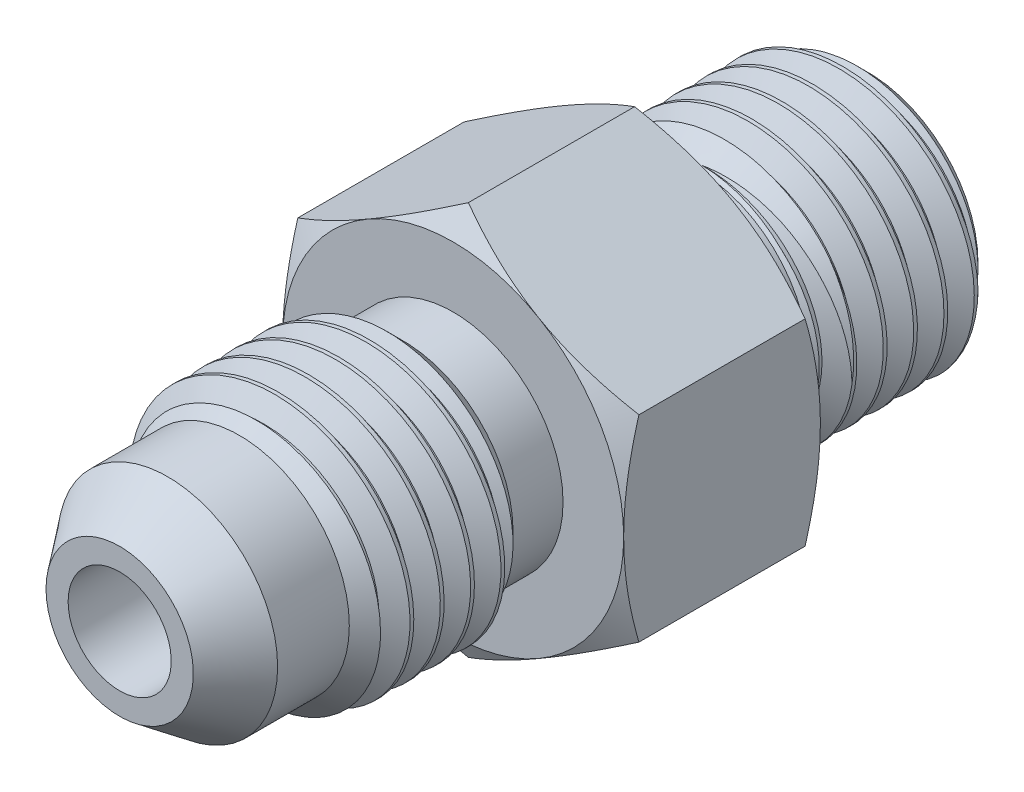
from build123d import *

# Parameters (mm, degrees)
BOSS_EXTRUDE1_DEPTH    = 8.239125
SKETCH6_OUTSIDE_W      = 98.49
SKETCH6_OUTSIDE_H      = 100.7
SKETCH6_OUTSIDE_R      = 7.14375
CUT_EXTRUDE1_DEPTH     = 21.524385925
CUT_EXTRUDE1_DRAFT     = -60
SKETCH7_OUTSIDE_W      = 113.112
SKETCH7_OUTSIDE_H      = 115.322
SKETCH7_OUTSIDE_R      = 7.14375
CUT_EXTRUDE2_DEPTH     = 25.745153386
CUT_EXTRUDE2_DRAFT     = -60
SKETCH8_R              = 0.47625
CUT_SWEEP1_PITCH       = 1.27
CUT_SWEEP1_HEIGHT      = 8.128
CUT_SWEEP1_RADIUS      = 5.55625
CUT_SWEEP1_START_ANGLE = 90
CUT_SWEEP2_PITCH       = 1.27
BOSS_EXTRUDE2_START    = -8.239125
SKETCH13_R             = 7.14375
SKETCH13_R_2           = 2.159
BOSS_EXTRUDE2_DEPTH    = 8.239125


with BuildPart() as part:
    # Sketch3 → Revolve1 (revolve)
    with BuildSketch(Plane(origin=(0, 0, 0), x_dir=(0, 0, -1), z_dir=(1, 0, 0)), mode=Mode.PRIVATE) as revolve1_sk:
        Polygon((-3.8020625, 4.60375), (-1.7065625, 4.60375), (6.5325625, 4.60375), (8.5645625, 4.60375), (9.5170625, 5.55625), (14.7240625, 5.55625), (15.6765625, 4.60375), (15.6765625, 2.159), (6.5325625, 2.159), (-1.7065625, 2.159), (-15.6765625, 2.159), (-15.6765625, 3.0861), (-13.662572926, 4.60375), (-10.6600625, 4.60375), (-9.7075625, 5.55625), (-4.7545625, 5.55625), align=None)
    revolve(revolve1_sk.sketch.rotate(Axis((0, 0, -15.6765625), (0, 0, 1)), 90), axis=Axis((0, 0, -15.6765625), (0, 0, 1)))

    # Sketch4 → Boss-Extrude1 (add)
    with BuildSketch(Plane.XY.offset(1.7065625)):
        Polygon((-7.14375, 4.124445986), (-7.14375, -4.124445986), (0, -8.248891971), (7.14375, -4.124445986), (7.14375, 4.124445986), (0, 8.248891971), align=None)
    extrude(amount=-BOSS_EXTRUDE1_DEPTH)

    # Sketch5 → Cut-Revolve1 (revolve, cut)
    with BuildSketch(Plane(origin=(0, 0, 0), x_dir=(0, 0, -1), z_dir=(1, 0, 0)), mode=Mode.PRIVATE) as cut_revolve1_sk:
        Polygon((15.6765625, 0), (-15.6765625, 0), (-15.6765625, 2.159), (-1.7065625, 2.159), (6.5325625, 2.159), (15.6765625, 2.159), align=None)
    revolve(cut_revolve1_sk.sketch.rotate(Axis((0, 0, -15.6765625), (0, 0, 1)), 90), axis=Axis((0, 0, -15.6765625), (0, 0, 1)), mode=Mode.SUBTRACT)


with BuildPart() as cut_extrude1_tool:
    # Sketch6 outside → Cut-Extrude1 (with draft: the straight prism first)
    with BuildSketch(Plane.XY.offset(1.7065625)):
        Rectangle(SKETCH6_OUTSIDE_W, SKETCH6_OUTSIDE_H)
        Circle(SKETCH6_OUTSIDE_R, mode=Mode.SUBTRACT)
    extrude(amount=-CUT_EXTRUDE1_DEPTH)
    # Cut-Extrude1: the draft: its side faces are tilted about the plane it starts from
    cut_extrude1_sides = [cut_extrude1_tool.faces().sort_by_distance(p)[0] for p in [
        (0, -50.35, -9.055630462),
        (49.245, 0, -9.055630462),
        (0, 50.35, -9.055630462),
        (-49.245, 0, -9.055630462),
        (-7.14375, 0, -9.055630462),
    ]]
    draft(cut_extrude1_sides, Plane.XY.offset(1.7065625), CUT_EXTRUDE1_DRAFT)


with BuildPart() as part_1:
    add(part.part)

    # Cut-Extrude1: cut by cut_extrude1_tool
    add(cut_extrude1_tool.part, mode=Mode.SUBTRACT)


with BuildPart() as cut_extrude2_tool:
    # Sketch7 outside → Cut-Extrude2 (with draft: the straight prism first)
    with BuildSketch(Plane(origin=(0, 0, -6.5325625), x_dir=(-1, 0, 0), z_dir=(0, 0, -1))):
        Rectangle(SKETCH7_OUTSIDE_W, SKETCH7_OUTSIDE_H)
        Circle(SKETCH7_OUTSIDE_R, mode=Mode.SUBTRACT)
    extrude(amount=-CUT_EXTRUDE2_DEPTH)
    # Cut-Extrude2: the draft: its side faces are tilted about the plane it starts from
    cut_extrude2_sides = [cut_extrude2_tool.faces().sort_by_distance(p)[0] for p in [
        (0, -57.661, 6.340014193),
        (-56.556, 0, 6.340014193),
        (0, 57.661, 6.340014193),
        (56.556, 0, 6.340014193),
        (7.14375, 0, 6.340014193),
    ]]
    draft(cut_extrude2_sides, Plane(origin=(0, 0, -6.5325625), x_dir=(-1, 0, 0), z_dir=(0, 0, -1)), CUT_EXTRUDE2_DRAFT)


with BuildPart() as part_2:
    add(part_1.part)

    # Cut-Extrude2: cut by cut_extrude2_tool
    add(cut_extrude2_tool.part, mode=Mode.SUBTRACT)

    # Cut-Sweep1: sweep along a helix
    with BuildLine() as cut_sweep1_path:
        add(Helix(CUT_SWEEP1_PITCH, CUT_SWEEP1_HEIGHT, CUT_SWEEP1_RADIUS, center=(0, 0, 10.6600625), direction=(0, 0, -1), mode=Mode.PRIVATE).rotate(Axis((0, 0, 10.6600625), (0, 0, -1)), CUT_SWEEP1_START_ANGLE))
    # Sketch10 → Cut-Sweep1 (sweep, cut)
    with BuildSketch(Plane(origin=(0, 0, 0), x_dir=(0, 0, -1), z_dir=(1, 0, 0))):
        Polygon((-11.2950625, 4.731360803), (-11.1363125, 4.731360803), (-10.620375, 5.624990766), (-11.811, 5.624990766), align=None)
    sweep(path=cut_sweep1_path.line, is_frenet=True, mode=Mode.SUBTRACT)

    # Cut-Sweep2: the profile of Sketch12 screwed along a right-hand helix of 6.6 turns, 8 arcs to a turn; built about Z, then put on its axis
    cut_sweep2_z = Axis((0, 0, 0), (0, 0, 1))
    cut_sweep2_corners = [(4.731360803, 0, -0.47625), (5.624990766, 0, 0.0396875), (5.624990766, 0, -1.1509375), (4.731360803, 0, -0.635)]
    with BuildLine(mode=Mode.PRIVATE) as cut_sweep2_profile:
        Line(cut_sweep2_corners[0], cut_sweep2_corners[1])
        Line(cut_sweep2_corners[1], cut_sweep2_corners[2])
        Line(cut_sweep2_corners[2], cut_sweep2_corners[3])
        Line(cut_sweep2_corners[3], cut_sweep2_corners[0])
    cut_sweep2_cap = Face(cut_sweep2_profile.wire())
    cut_sweep2_turn_angles = [0, 22.5, 45, 67.5, 90, 112.5, 135, 157.5, 180, 202.5, 225, 247.5, 270, 292.5, 315, 337.5, 360]
    cut_sweep2_turn_weights = [1, 0.9238795325112867, 1, 0.9238795325112867, 1, 0.9238795325112867, 1, 0.9238795325112867, 1, 0.9238795325112867, 1, 0.9238795325112867, 1, 0.9238795325112867, 1, 0.9238795325112867, 1]
    cut_sweep2_turn_rails = [Edge.make_bspline([Vector(p[0], p[1], 0).rotate(cut_sweep2_z, cut_sweep2_turn_angles[k]) / cut_sweep2_turn_weights[k] + Vector(0, 0, p[2] + CUT_SWEEP2_PITCH * cut_sweep2_turn_angles[k] / 360) for k in range(17)], [0, 0, 0, 1, 1, 2, 2, 3, 3, 4, 4, 5, 5, 6, 6, 7, 7, 8, 8, 8], 2, cut_sweep2_turn_weights) for p in cut_sweep2_corners]
    cut_sweep2_turn_sides = [Face.make_surface_from_curves(cut_sweep2_turn_rails[p[0]], cut_sweep2_turn_rails[p[1]]) for p in [(0, 1), (1, 2), (2, 3), (3, 0)]]
    cut_sweep2_last_angles = [2160, 2182.5, 2205, 2227.5, 2250, 2272.5, 2295, 2317.5, 2340, 2358, 2376]
    cut_sweep2_last_weights = [1, 0.9238795325112867, 1, 0.9238795325112867, 1, 0.9238795325112867, 1, 0.9238795325112867, 1, 0.951056516295145, 1]
    cut_sweep2_last_rails = [Edge.make_bspline([Vector(p[0], p[1], 0).rotate(cut_sweep2_z, cut_sweep2_last_angles[k]) / cut_sweep2_last_weights[k] + Vector(0, 0, p[2] + CUT_SWEEP2_PITCH * cut_sweep2_last_angles[k] / 360) for k in range(11)], [0, 0, 0, 1, 1, 2, 2, 3, 3, 4, 4, 5, 5, 5], 2, cut_sweep2_last_weights) for p in cut_sweep2_corners]
    cut_sweep2_last_sides = [Face.make_surface_from_curves(cut_sweep2_last_rails[p[0]], cut_sweep2_last_rails[p[1]]) for p in [(0, 1), (1, 2), (2, 3), (3, 0)]]
    cut_sweep2 = Plane(origin=(0, 0, -15.6765625), x_dir=(0, 1, 0), z_dir=(0, 0, 1)) * Solid(Shell([*[p.moved(Location((0, 0, CUT_SWEEP2_PITCH * i))) for i in range(6) for p in cut_sweep2_turn_sides], *cut_sweep2_last_sides, cut_sweep2_cap, cut_sweep2_cap.rotate(cut_sweep2_z, 2376).moved(Location((0, 0, CUT_SWEEP2_PITCH * 2376 / 360)))]))
    add(cut_sweep2, mode=Mode.SUBTRACT)

    # Sketch13 → Boss-Extrude2 (add)
    with BuildSketch(Plane(origin=(0, 0, -6.5325625), x_dir=(-1, 0, 0), z_dir=(0, 0, -1)).offset(BOSS_EXTRUDE2_START)):
        Circle(SKETCH13_R)
        Circle(SKETCH13_R_2, mode=Mode.SUBTRACT)
    extrude(amount=BOSS_EXTRUDE2_DEPTH)


with BuildPart() as body_2:
    # Sketch8 → Revolve2 (revolve)
    with BuildSketch(Plane(origin=(0, 0, 0), x_dir=(0, 0, -1), z_dir=(1, 0, 0)), mode=Mode.PRIVATE) as revolve2_sk:
        with Locations((7.0088125, 5.08)):
            Circle(SKETCH8_R)
    revolve(revolve2_sk.sketch.rotate(Axis((0, 0, -15.6765625), (0, 0, 1)), 90), axis=Axis((0, 0, -15.6765625), (0, 0, 1)))


solid = Compound([part_2.part, body_2.part])
